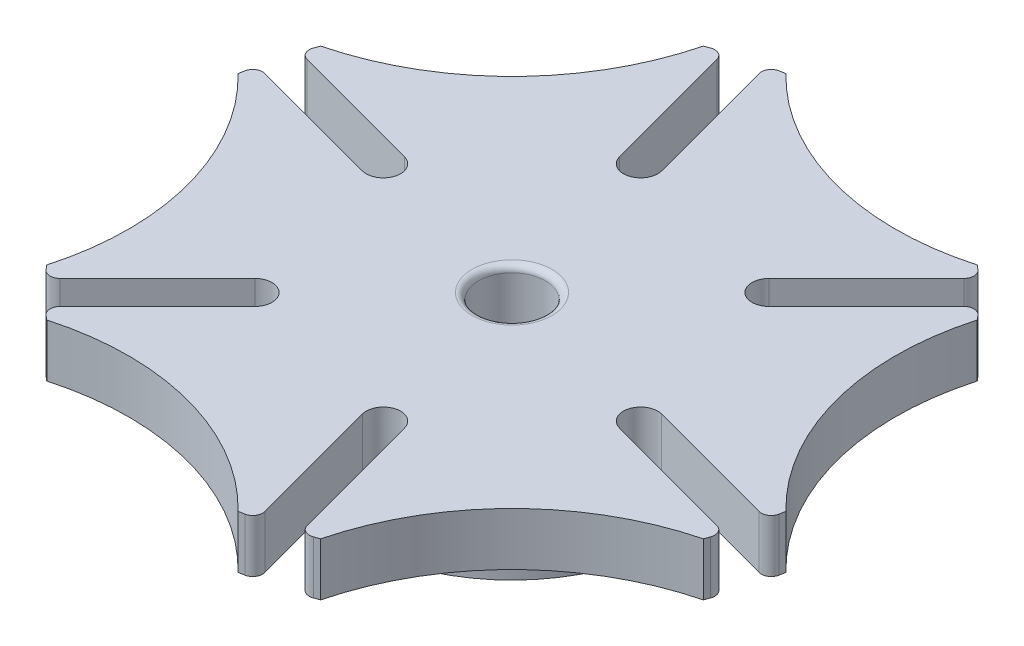
from build123d import *

# Parameters (mm, degrees)
SKETCH1_R           = 63.5
BOSS_EXTRUDE1_DEPTH = 10.16
SKETCH2_R           = 50.8
CUT_EXTRUDE1_DEPTH  = 91.375470123
CIRPATTERN1_COUNT   = 6
CUT_EXTRUDE2_DEPTH  = 90.240886157
SKETCH4_R           = 6.4135
CUT_EXTRUDE3_DEPTH  = 90.240886157
CIRPATTERN2_COUNT   = 6
FILLET1_R           = 1.905
SKETCH5_R           = 31.75
BOSS_EXTRUDE2_DEPTH = 15.24
SKETCH6_R           = 6.4135
CUT_EXTRUDE4_DEPTH  = 90.960923529
FILLET2_R           = 2.54
FILLET3_R           = 5.08
FILLET4_R           = 1.27


with BuildPart() as part:
    # Sketch1 → Boss-Extrude1 (new body)
    with BuildSketch(Plane(origin=(0, 0, 0), x_dir=(1, 0, 0), z_dir=(0, 1, 0))):
        with Locations(Location((0, 0, 0), (0, 0, 270))):
            Circle(SKETCH1_R)
    extrude(amount=BOSS_EXTRUDE1_DEPTH)

    # Sketch2 → Cut-Extrude1 (cut, through all)
    with BuildSketch(Plane(origin=(0, 10.16, 0), x_dir=(1, 0, 0), z_dir=(0, 1, 0))):
        with Locations((-71.842048969, 71.842048969)):
            Circle(SKETCH2_R)
    cut_extrude1 = extrude(amount=-CUT_EXTRUDE1_DEPTH, mode=Mode.SUBTRACT)

    # CirPattern1: Cut-Extrude1 ×6 about axis
    cirpattern1_axis = Axis((0, 0, 0), (0, 1, 0))
    for i in range(1, CIRPATTERN1_COUNT):
        add(cut_extrude1.rotate(cirpattern1_axis, i * 360 / CIRPATTERN1_COUNT), mode=Mode.SUBTRACT)

    # Sketch3 → Cut-Extrude2 (cut, through all)
    with BuildSketch(Plane(origin=(0, 10.16, 0), x_dir=(1, 0, 0), z_dir=(0, 1, 0))):
        with BuildLine():
            Line((-60.481669482, 19.624496442), (-32.880338996, 12.228742229))
            ThreePointArc((-32.880338996, 12.228742229), (-30.545472405, 8.184634663), (-34.58957997, 5.849768072))
            Line((-34.58957997, 5.849768072), (-62.190910456, 13.245522286))
            ThreePointArc((-62.190910456, 13.245522286), (-64.525777048, 17.289629851), (-60.481669482, 19.624496442))
        make_face()
    cut_extrude2 = extrude(amount=-CUT_EXTRUDE2_DEPTH, mode=Mode.SUBTRACT)

    # Sketch4 → Cut-Extrude3 (cut, through all)
    with BuildSketch(Plane(origin=(0, 10.16, 0), x_dir=(1, 0, 0), z_dir=(0, 1, 0))):
        with Locations(Location((0, 0, 0), (0, 0, 270))):
            Circle(SKETCH4_R)
    extrude(amount=-CUT_EXTRUDE3_DEPTH, mode=Mode.SUBTRACT)

    # CirPattern2: Cut-Extrude2 ×6 about axis
    cirpattern2_axis = Axis((0, 0, 0), (0, 1, 0))
    for i in range(1, CIRPATTERN2_COUNT):
        add(cut_extrude2.rotate(cirpattern2_axis, i * 360 / CIRPATTERN2_COUNT), mode=Mode.SUBTRACT)

    # Fillet1
    fillet1_edges = [part.edges().sort_by_distance(p)[0] for p in [
        (-47.175399572, 5.08, 42.505666389),
        (-42.505666389, 5.08, 47.175399572),
        (13.223287112, 5.08, 62.107927658),
        (19.602261269, 5.08, 60.398686684),
        (60.398686684, 5.08, 19.602261269),
        (62.107927658, 5.08, 13.223287112),
        (47.175399572, 5.08, -42.505666389),
        (42.505666389, 5.08, -47.175399572),
        (-13.223287112, 5.08, -62.107927658),
        (-19.602261269, 5.08, -60.398686684),
        (-60.398686684, 5.08, -19.602261269),
        (-62.107927658, 5.08, -13.223287112),
    ]]
    fillet(fillet1_edges, radius=FILLET1_R)

    # Sketch5 → Boss-Extrude2 (add)
    with BuildSketch(Plane(origin=(0, 0, 0), x_dir=(-1, 0, 0), z_dir=(0, -1, 0))):
        with Locations(Location((0, 0, 0), (0, 0, 256.560575533))):
            Circle(SKETCH5_R)
    extrude(amount=BOSS_EXTRUDE2_DEPTH)

    # Sketch6 → Cut-Extrude4 (cut, through all)
    with BuildSketch(Plane(origin=(0, 0, 0), x_dir=(1, 0, 0), z_dir=(0, 1, 0))):
        with Locations(Location((0, 0, 0), (0, 0, 270))):
            Circle(SKETCH6_R)
    extrude(amount=-CUT_EXTRUDE4_DEPTH, mode=Mode.SUBTRACT)

    # Fillet2
    # the kernel refuses this fillet: 2.54 mm, written as the material it adds along each edge
    with BuildSketch(Plane(origin=(0, 0, 0), x_dir=(0.5749992742751929, 0, -0.8181539186381751), z_dir=(-0.8181539186381751, 0, -0.5749992742751929))) as fillet2_piece_1_section:
        with BuildLine():
            CenterArc((31.75 + FILLET2_R, FILLET2_R), FILLET2_R, 180, 90)
            Line((31.75 + FILLET2_R, 0), (31.75, 0))
            Line((31.75, 0), (31.75, FILLET2_R))
        make_face()
    fillet2_piece_1 = revolve(axis=Axis((0, 0, 0), (0, -1, 0)), revolution_arc=79.800837255, mode=Mode.PRIVATE)
    fillet2_piece_1 = fillet2_piece_1 - Plane(origin=(33.734959483, -0.606371024, 9.03925515), x_dir=(-0.2588190451025229, 0, 0.9659258262890678), z_dir=(0, 1, 0)) * Cylinder(3.302, 138, mode=Mode.PRIVATE)
    fillet2_piece_1 = fillet2_piece_1 - Plane(origin=(24.695704333, -0.606371024, -24.695704333), x_dir=(0.7071067811865457, 0, 0.7071067811865495), z_dir=(0, 1, 0)) * Cylinder(3.302, 138, mode=Mode.PRIVATE)
    add(fillet2_piece_1)
    with BuildSketch(Plane(origin=(0, 0, 0), x_dir=(0.9960417148840375, 0, 0.08888701936090508), z_dir=(0.08888701936090508, 0, -0.9960417148840375))) as fillet2_piece_2_section:
        with BuildLine():
            CenterArc((31.75 + FILLET2_R, FILLET2_R), FILLET2_R, 180, 90)
            Line((31.75 + FILLET2_R, 0), (31.75, 0))
            Line((31.75, 0), (31.75, FILLET2_R))
        make_face()
    fillet2_piece_2 = revolve(axis=Axis((0, 0, 0), (0, -1, 0)), revolution_arc=79.800837255, mode=Mode.PRIVATE)
    fillet2_piece_2 = fillet2_piece_2 - Plane(origin=(9.03925515, -0.606371024, 33.734959483), x_dir=(-0.965925826289069, 0, 0.2588190451025186), z_dir=(0, 1, 0)) * Cylinder(3.302, 138, mode=Mode.PRIVATE)
    fillet2_piece_2 = fillet2_piece_2 - Plane(origin=(33.734959483, -0.606371024, 9.03925515), x_dir=(-0.2588190451025229, 0, 0.9659258262890678), z_dir=(0, 1, 0)) * Cylinder(3.302, 138, mode=Mode.PRIVATE)
    add(fillet2_piece_2)
    with BuildSketch(Plane(origin=(0, 0, 0), x_dir=(0.4210424406137115, 0, 0.9070409379967639), z_dir=(0.9070409379967639, 0, -0.4210424406137115))) as fillet2_piece_3_section:
        with BuildLine():
            CenterArc((31.75 + FILLET2_R, FILLET2_R), FILLET2_R, 180, 90)
            Line((31.75 + FILLET2_R, 0), (31.75, 0))
            Line((31.75, 0), (31.75, FILLET2_R))
        make_face()
    fillet2_piece_3 = revolve(axis=Axis((0, 0, 0), (0, -1, 0)), revolution_arc=79.800837255, mode=Mode.PRIVATE)
    fillet2_piece_3 = fillet2_piece_3 - Plane(origin=(9.03925515, -0.606371024, 33.734959483), x_dir=(-0.965925826289069, 0, 0.2588190451025186), z_dir=(0, 1, 0)) * Cylinder(3.302, 138, mode=Mode.PRIVATE)
    fillet2_piece_3 = fillet2_piece_3 - Plane(origin=(-24.695704333, -0.606371024, 24.695704333), x_dir=(-0.7071067811865459, 0, -0.7071067811865491), z_dir=(0, 1, 0)) * Cylinder(3.302, 138, mode=Mode.PRIVATE)
    add(fillet2_piece_3)
    with BuildSketch(Plane(origin=(0, 0, 0), x_dir=(-0.5749992742751904, 0, 0.8181539186381769), z_dir=(0.8181539186381769, 0, 0.5749992742751904))) as fillet2_piece_4_section:
        with BuildLine():
            CenterArc((31.75 + FILLET2_R, FILLET2_R), FILLET2_R, 180, 90)
            Line((31.75 + FILLET2_R, 0), (31.75, 0))
            Line((31.75, 0), (31.75, FILLET2_R))
        make_face()
    fillet2_piece_4 = revolve(axis=Axis((0, 0, 0), (0, -1, 0)), revolution_arc=79.800837255, mode=Mode.PRIVATE)
    fillet2_piece_4 = fillet2_piece_4 - Plane(origin=(-24.695704333, -0.606371024, 24.695704333), x_dir=(-0.7071067811865459, 0, -0.7071067811865491), z_dir=(0, 1, 0)) * Cylinder(3.302, 138, mode=Mode.PRIVATE)
    fillet2_piece_4 = fillet2_piece_4 - Plane(origin=(-33.734959483, -0.606371024, -9.03925515), x_dir=(0.2588190451025228, 0, -0.9659258262890678), z_dir=(0, 1, 0)) * Cylinder(3.302, 138, mode=Mode.PRIVATE)
    add(fillet2_piece_4)
    with BuildSketch(Plane(origin=(0, 0, 0), x_dir=(-0.9960417148840376, 0, -0.08888701936090405), z_dir=(-0.08888701936090405, 0, 0.9960417148840376))) as fillet2_piece_5_section:
        with BuildLine():
            CenterArc((31.75 + FILLET2_R, FILLET2_R), FILLET2_R, 180, 90)
            Line((31.75 + FILLET2_R, 0), (31.75, 0))
            Line((31.75, 0), (31.75, FILLET2_R))
        make_face()
    fillet2_piece_5 = revolve(axis=Axis((0, 0, 0), (0, -1, 0)), revolution_arc=79.800837255, mode=Mode.PRIVATE)
    fillet2_piece_5 = fillet2_piece_5 - Plane(origin=(-33.734959483, -0.606371024, -9.03925515), x_dir=(0.2588190451025228, 0, -0.9659258262890678), z_dir=(0, 1, 0)) * Cylinder(3.302, 138, mode=Mode.PRIVATE)
    fillet2_piece_5 = fillet2_piece_5 - Plane(origin=(-9.03925515, -0.606371024, -33.734959483), x_dir=(0.9659258262890689, 0, -0.25881904510251885), z_dir=(0, 1, 0)) * Cylinder(3.302, 138, mode=Mode.PRIVATE)
    add(fillet2_piece_5)
    with BuildSketch(Plane(origin=(0, 0, 0), x_dir=(-0.4210424406088149, 0, -0.907040937999037), z_dir=(-0.907040937999037, 0, 0.4210424406088149))) as fillet2_piece_6_section:
        with BuildLine():
            CenterArc((31.75 + FILLET2_R, FILLET2_R), FILLET2_R, 180, 90)
            Line((31.75 + FILLET2_R, 0), (31.75, 0))
            Line((31.75, 0), (31.75, FILLET2_R))
        make_face()
    fillet2_piece_6 = revolve(axis=Axis((0, 0, 0), (0, -1, 0)), revolution_arc=79.800837255, mode=Mode.PRIVATE)
    fillet2_piece_6 = fillet2_piece_6 - Plane(origin=(24.695704333, -0.606371024, -24.695704333), x_dir=(0.7071067811865457, 0, 0.7071067811865495), z_dir=(0, 1, 0)) * Cylinder(3.302, 138, mode=Mode.PRIVATE)
    fillet2_piece_6 = fillet2_piece_6 - Plane(origin=(-9.03925515, -0.606371024, -33.734959483), x_dir=(0.9659258262890689, 0, -0.25881904510251885), z_dir=(0, 1, 0)) * Cylinder(3.302, 138, mode=Mode.PRIVATE)
    add(fillet2_piece_6)

    # Fillet3
    fillet3_edges = [part.edges().sort_by_distance(p)[0] for p in [
        (0, -15.24, -6.4135),
    ]]
    fillet(fillet3_edges, radius=FILLET3_R)

    # Fillet4
    fillet4_edges = [part.edges().sort_by_distance(p)[0] for p in [
        (0, 10.16, -6.4135),
    ]]
    fillet(fillet4_edges, radius=FILLET4_R)


solid = part.part
